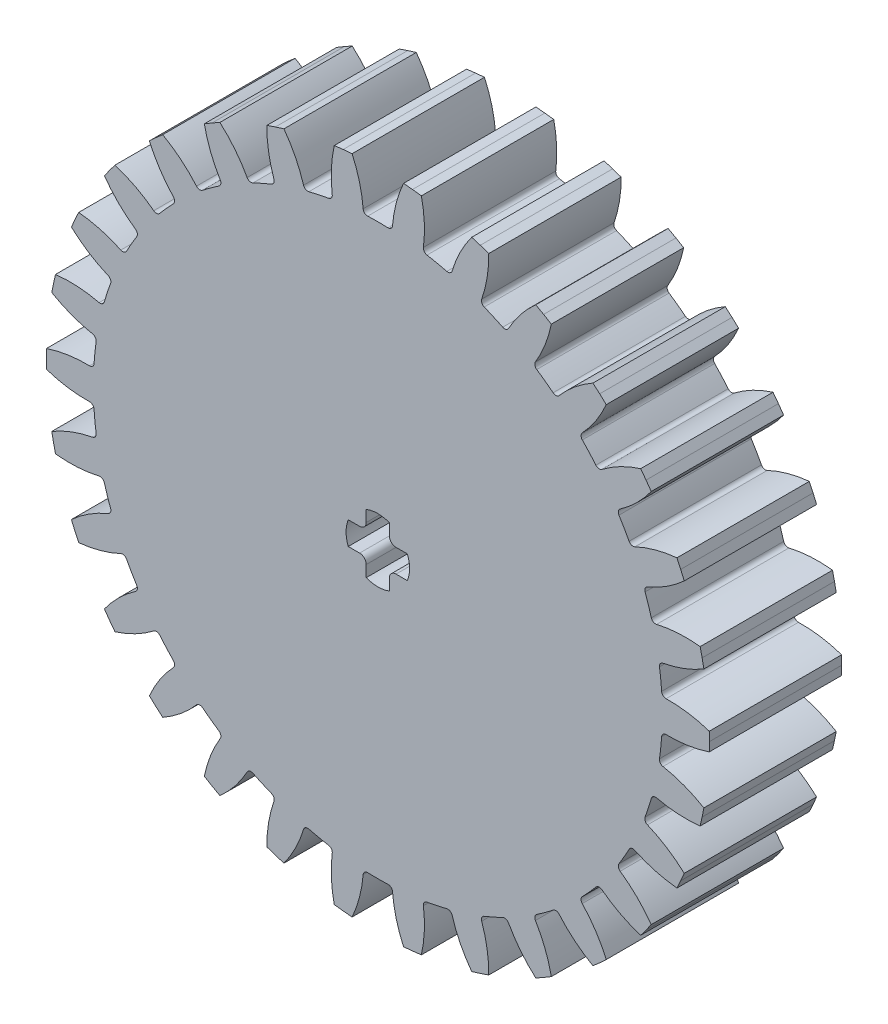
from build123d import *

# Parameters (mm, degrees)
BOSS_EXTRUDE1_DEPTH      = 10
FILLET1_R                = 0.3325
CIRPATTERN1_COUNT        = 30
FILLET1_OF_CIRPATTERN1_R = 0.3325
CUT_EXTRUDE1_REACH       = 38.759


with BuildPart() as part:
    # Sketch1 → Boss-Extrude1 (new body)
    with BuildSketch(Plane.XY):
        with BuildLine():
            Line((25.040834221, 0.677585061), (25.05, 0))
            Line((25.05, 0), (25.040834221, -0.677585061))
            ThreePointArc((25.040834221, -0.677585061), (23.273874213, -1.0893045), (21.461049387, -1.162288888))
            ThreePointArc((21.461049387, -1.162288888), (21.424766078, -1.704979397), (21.374761836, -2.246577997))
            Line((21.374761836, -2.246577997), (0, 0))
            Line((0, 0), (21.374761836, 2.246577997))
            ThreePointArc((21.374761836, 2.246577997), (21.424766078, 1.704979397), (21.461049387, 1.162288888))
            ThreePointArc((21.461049387, 1.162288888), (23.273874213, 1.0893045), (25.040834221, 0.677585061))
        make_face()
    boss_extrude1 = extrude(amount=BOSS_EXTRUDE1_DEPTH)

    # Fillet1
    fillet1_edges = [part.edges().sort_by_distance(p)[0] for p in [
        (21.461049387, 1.162288888, 5),
        (21.461049387, -1.162288888, 5),
    ]]
    fillet(fillet1_edges, radius=FILLET1_R)

    # CirPattern1: Boss-Extrude1 ×30 about axis
    cirpattern1_axis = Axis((0, 0, 10), (0, 0, -1))
    for i in range(1, CIRPATTERN1_COUNT):
        add(boss_extrude1.rotate(cirpattern1_axis, i * 360 / CIRPATTERN1_COUNT))

    # Fillet1 of CirPattern1
    fillet1_of_cirpattern1_edges = [part.edges().sort_by_distance(p)[0] for p in [
        (21.233727415, -3.325112978, 5),
        (20.750420519, -5.598893152, 5),
        (20.078389664, -7.66719145, 5),
        (19.132898703, -9.790798919, 5),
        (18.045529939, -11.674176866, 5),
        (16.679177404, -13.554799791, 5),
        (15.223993962, -15.170944733, 5),
        (13.496496017, -16.72639087, 5),
        (11.737096397, -18.004669517, 5),
        (9.72395299, -19.166958405, 5),
        (7.737231399, -20.051503847, 5),
        (5.526426557, -20.769837885, 5),
        (3.39921226, -21.221991242, 5),
        (1.087368765, -21.464975784, 5),
        (-1.087368765, -21.464975784, 5),
        (-3.39921226, -21.221991242, 5),
        (-5.526426557, -20.769837885, 5),
        (-7.737231399, -20.051503847, 5),
        (-9.72395299, -19.166958405, 5),
        (-11.737096397, -18.004669517, 5),
        (-13.496496017, -16.72639087, 5),
        (-15.223993962, -15.170944733, 5),
        (-16.679177404, -13.554799791, 5),
        (-18.045529939, -11.674176866, 5),
        (-19.132898703, -9.790798919, 5),
        (-20.078389664, -7.66719145, 5),
        (-20.750420519, -5.598893152, 5),
        (-21.233727415, -3.325112978, 5),
        (-21.461049387, -1.162288888, 5),
        (-21.461049387, 1.162288888, 5),
        (-21.233727415, 3.325112978, 5),
        (-20.750420519, 5.598893152, 5),
        (-20.078389664, 7.66719145, 5),
        (-19.132898703, 9.790798919, 5),
        (-18.045529939, 11.674176866, 5),
        (-16.679177404, 13.554799791, 5),
        (-15.223993962, 15.170944733, 5),
        (-13.496496017, 16.72639087, 5),
        (-11.737096397, 18.004669517, 5),
        (-9.72395299, 19.166958405, 5),
        (-7.737231399, 20.051503847, 5),
        (-5.526426557, 20.769837885, 5),
        (-3.39921226, 21.221991242, 5),
        (-1.087368765, 21.464975784, 5),
        (1.087368765, 21.464975784, 5),
        (3.39921226, 21.221991242, 5),
        (5.526426557, 20.769837885, 5),
        (7.737231399, 20.051503847, 5),
        (9.72395299, 19.166958405, 5),
        (11.737096397, 18.004669517, 5),
        (13.496496017, 16.72639087, 5),
        (15.223993962, 15.170944733, 5),
        (16.679177404, 13.554799791, 5),
        (18.045529939, 11.674176866, 5),
        (19.132898703, 9.790798919, 5),
        (20.078389664, 7.66719145, 5),
        (20.750420519, 5.598893152, 5),
        (21.233727415, 3.325112978, 5),
    ]]
    fillet(fillet1_of_cirpattern1_edges, radius=FILLET1_OF_CIRPATTERN1_R)

    # Sketch2 → Cut-Extrude1 (cut, up to next)
    with BuildSketch(Plane(origin=(0, 0, 0), x_dir=(-1, 0, 0), z_dir=(0, 0, -1)), mode=Mode.PRIVATE) as cut_extrude1_sk1:
        with BuildLine():
            Line((0.875, 2.234809835), (0.875, 1.375))
            ThreePointArc((0.875, 1.375), (1.021446609, 1.021446609), (1.375, 0.875))
            Line((1.375, 0.875), (2.234809835, 0.875))
            ThreePointArc((2.234809835, 0.875), (2.4, 0), (2.234809835, -0.875))
            Line((2.234809835, -0.875), (1.375, -0.875))
            ThreePointArc((1.375, -0.875), (1.021446609, -1.021446609), (0.875, -1.375))
            Line((0.875, -1.375), (0.875, -2.234809835))
            ThreePointArc((0.875, -2.234809835), (0, -2.4), (-0.875, -2.234809835))
            Line((-0.875, -2.234809835), (-0.875, -1.375))
            ThreePointArc((-0.875, -1.375), (-1.021446609, -1.021446609), (-1.375, -0.875))
            Line((-1.375, -0.875), (-2.234809835, -0.875))
            ThreePointArc((-2.234809835, -0.875), (-2.4, 0), (-2.234809835, 0.875))
            Line((-2.234809835, 0.875), (-1.375, 0.875))
            ThreePointArc((-1.375, 0.875), (-1.021446609, 1.021446609), (-0.875, 1.375))
            Line((-0.875, 1.375), (-0.875, 2.234809835))
            ThreePointArc((-0.875, 2.234809835), (0, 2.4), (0.875, 2.234809835))
        make_face()
    cut_extrude1_tool1 = extrude(cut_extrude1_sk1.sketch, amount=-CUT_EXTRUDE1_REACH, mode=Mode.PRIVATE) & part.part
    add(cut_extrude1_tool1.solids().sort_by_distance((0, 0, 0))[0], mode=Mode.SUBTRACT)


solid = part.part
